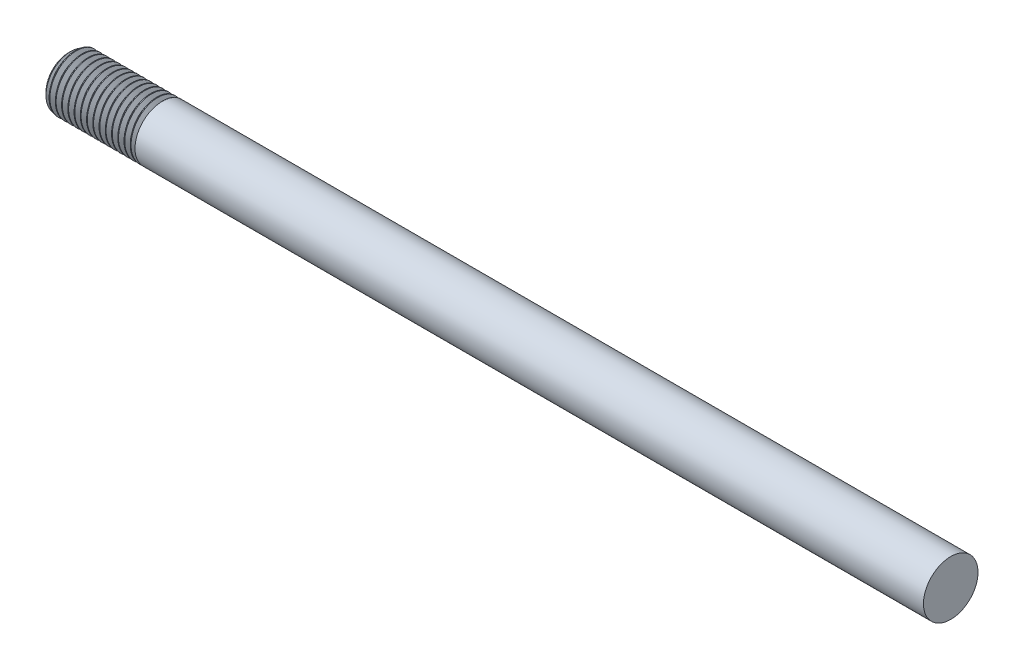
from build123d import *

# Parameters (mm, degrees)
SKETCH2_W        = 19.05
SKETCH2_H        = 5.55625
CHAMFER1_SIZE    = 0.9525
CUT_SWEEP1_PITCH = 1.27
SKETCH18_W       = 160.401
SKETCH18_H       = 5.5499


with BuildPart() as part:
    # Sketch2 → Revolve1 (revolve)
    with BuildSketch(Plane.XY, mode=Mode.PRIVATE) as revolve1_sk:
        with Locations((-136.652, 2.778125)):
            Rectangle(SKETCH2_W, SKETCH2_H)
    revolve(revolve1_sk.sketch.rotate(Axis((-146.177, 0, 0), (1, 0, 0)), 90), axis=Axis((-146.177, 0, 0), (1, 0, 0)))

    # Chamfer1
    chamfer1_edges = [part.edges().sort_by_distance(p)[0] for p in [
        (-146.177, 0, -5.55625),
    ]]
    chamfer(chamfer1_edges, length=CHAMFER1_SIZE)

    # Cut-Sweep1: the profile of Sketch4 profile screwed along a right-hand helix of 16 turns, 8 arcs to a turn; built about Z, then put on its axis
    cut_sweep1_z = Axis((0, 0, 0), (0, 0, 1))
    cut_sweep1_corners = [(5.55655, 0, -1.111423205), (5.55655, 0, 0.000173205), (4.731360803, 0, -0.47625), (4.731360803, 0, -0.635)]
    with BuildLine(mode=Mode.PRIVATE) as cut_sweep1_profile:
        Line(cut_sweep1_corners[0], cut_sweep1_corners[1])
        Line(cut_sweep1_corners[1], cut_sweep1_corners[2])
        Line(cut_sweep1_corners[2], cut_sweep1_corners[3])
        Line(cut_sweep1_corners[3], cut_sweep1_corners[0])
    cut_sweep1_cap = Face(cut_sweep1_profile.wire())
    cut_sweep1_turn_angles = [0, 22.5, 45, 67.5, 90, 112.5, 135, 157.5, 180, 202.5, 225, 247.5, 270, 292.5, 315, 337.5, 360]
    cut_sweep1_turn_weights = [1, 0.9238795325112867, 1, 0.9238795325112867, 1, 0.9238795325112867, 1, 0.9238795325112867, 1, 0.9238795325112867, 1, 0.9238795325112867, 1, 0.9238795325112867, 1, 0.9238795325112867, 1]
    cut_sweep1_turn_rails = [Edge.make_bspline([Vector(p[0], p[1], 0).rotate(cut_sweep1_z, cut_sweep1_turn_angles[k]) / cut_sweep1_turn_weights[k] + Vector(0, 0, p[2] + CUT_SWEEP1_PITCH * cut_sweep1_turn_angles[k] / 360) for k in range(17)], [0, 0, 0, 1, 1, 2, 2, 3, 3, 4, 4, 5, 5, 6, 6, 7, 7, 8, 8, 8], 2, cut_sweep1_turn_weights) for p in cut_sweep1_corners]
    cut_sweep1_turn_sides = [Face.make_surface_from_curves(cut_sweep1_turn_rails[p[0]], cut_sweep1_turn_rails[p[1]]) for p in [(0, 1), (1, 2), (2, 3), (3, 0)]]
    cut_sweep1 = Plane(origin=(-146.177, 0, 0), x_dir=(0, 1, 0), z_dir=(1, 0, 0)) * Solid(Shell([*[p.moved(Location((0, 0, CUT_SWEEP1_PITCH * i))) for i in range(16) for p in cut_sweep1_turn_sides], cut_sweep1_cap, cut_sweep1_cap.rotate(cut_sweep1_z, 5760).moved(Location((0, 0, CUT_SWEEP1_PITCH * 5760 / 360)))]))
    add(cut_sweep1, mode=Mode.SUBTRACT)

    # Sketch18 → Revolve4 (revolve)
    with BuildSketch(Plane.XY, mode=Mode.PRIVATE) as revolve4_sk:
        with Locations((-46.9265, 2.77495)):
            Rectangle(SKETCH18_W, SKETCH18_H)
    revolve(revolve4_sk.sketch.rotate(Axis((-127.127, 0, 0), (1, 0, 0)), 270), axis=Axis((-127.127, 0, 0), (1, 0, 0)))


solid = part.part
